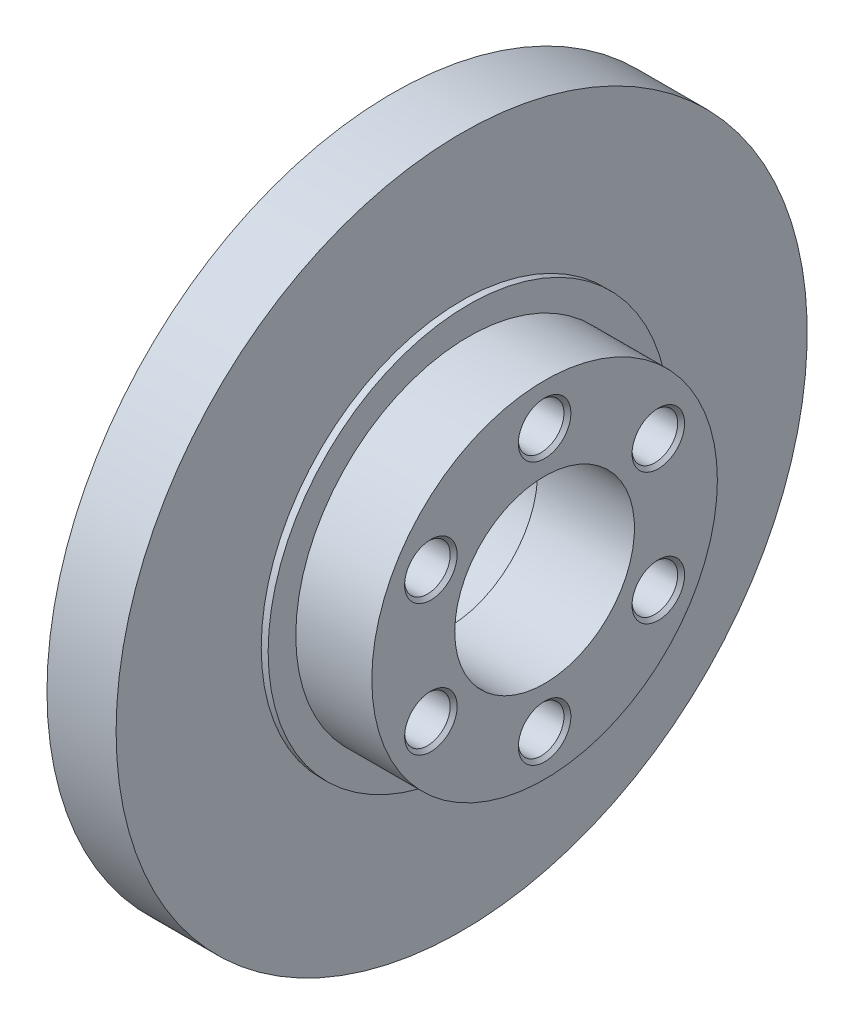
from build123d import *

# Parameters (mm, degrees)
SKETCH3_R          = 2.5
CUT_EXTRUDE1_DEPTH = 4
SKETCH4_R          = 3.3
CUT_EXTRUDE2_DEPTH = 10
CHAMFER1_SIZE      = 0.5


with BuildPart() as part:
    # Sketch2 → Revolve1 (revolve)
    with BuildSketch(Plane.XY):
        Polygon((0, 50), (10, 50), (10, 29), (11, 29), (11, 25), (22, 25), (22, 13), (8, 13), (8, 14), (0, 14), align=None)
    revolve(axis=Axis((0, 0, 0), (1, 0, 0)))

    # Sketch3 → Cut-Extrude1 (cut)
    with BuildSketch(Plane(origin=(0, 0, 0), x_dir=(0, 0, -1), z_dir=(1, 0, 0))):
        with Locations((0, 40)):
            Circle(SKETCH3_R)
        with Locations((28.284271247, 28.284271247)):
            Circle(SKETCH3_R)
        with Locations((40, 0)):
            Circle(SKETCH3_R)
        with Locations((28.284271247, -28.284271247)):
            Circle(SKETCH3_R)
        with Locations((0, -40)):
            Circle(SKETCH3_R)
        with Locations((-28.284271247, -28.284271247)):
            Circle(SKETCH3_R)
        with Locations((-40, 0)):
            Circle(SKETCH3_R)
        with Locations((-28.284271247, 28.284271247)):
            Circle(SKETCH3_R)
    extrude(amount=CUT_EXTRUDE1_DEPTH, mode=Mode.SUBTRACT)

    # Sketch4 → Cut-Extrude2 (cut)
    with BuildSketch(Plane(origin=(22, 0, 0), x_dir=(0, 0, -1), z_dir=(1, 0, 0))):
        with Locations((0, 19)):
            Circle(SKETCH4_R)
        with Locations((16.454482672, 9.5)):
            Circle(SKETCH4_R)
        with Locations((16.454482672, -9.5)):
            Circle(SKETCH4_R)
        with Locations((0, -19)):
            Circle(SKETCH4_R)
        with Locations((-16.454482672, -9.5)):
            Circle(SKETCH4_R)
        with Locations((-16.454482672, 9.5)):
            Circle(SKETCH4_R)
    extrude(amount=-CUT_EXTRUDE2_DEPTH, mode=Mode.SUBTRACT)

    # Chamfer1
    chamfer1_edges = [part.edges().sort_by_distance(p)[0] for p in [
        (22, 9.5, 19.754482672),
        (22, -9.5, 19.754482672),
        (22, -19, 3.3),
        (22, -9.5, -13.154482672),
        (22, 9.5, -13.154482672),
        (22, 19, 3.3),
    ]]
    chamfer(chamfer1_edges, length=CHAMFER1_SIZE)


solid = part.part
